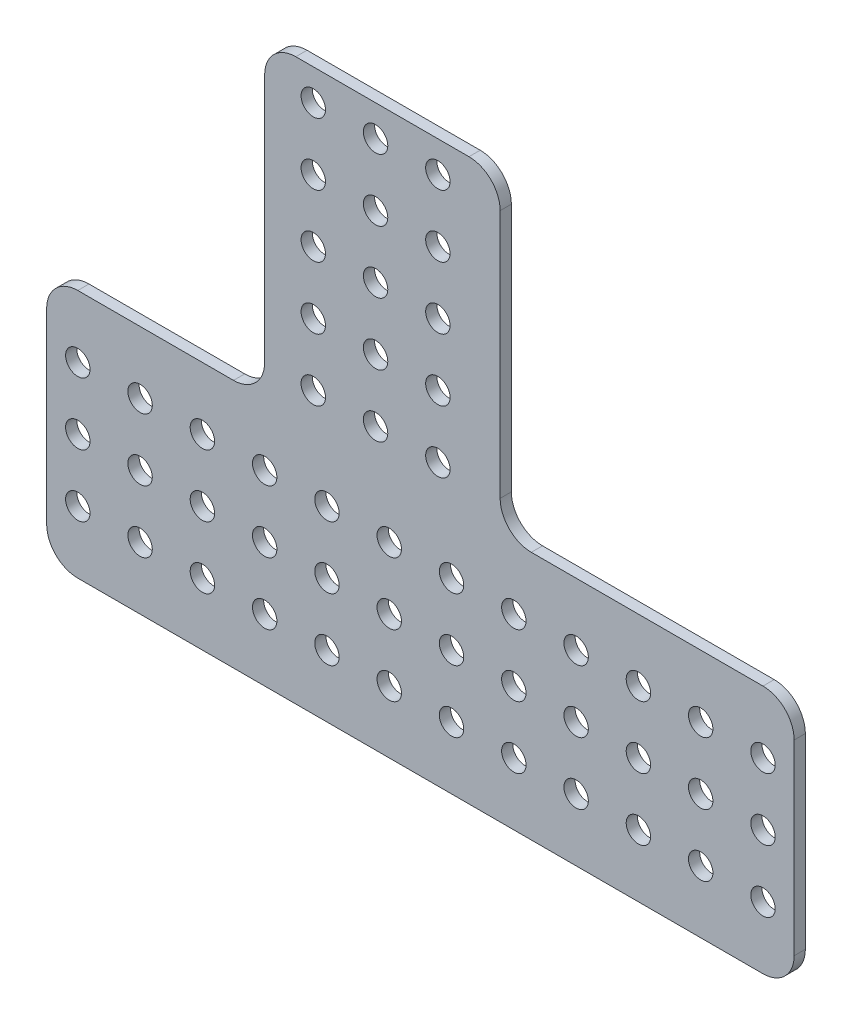
from build123d import *

# Parameters (mm, degrees)
SKETCH1_R           = 2.4892
BOSS_EXTRUDE1_DEPTH = 2.286


with BuildPart() as part:
    # Sketch1 → Boss-Extrude1 (new body)
    with BuildSketch(Plane.XY):
        with BuildLine():
            Line((-255.429010331, 188.842880428), (-220.118407496, 188.842880428))
            ThreePointArc((-220.118407496, 188.842880428), (-215.628279435, 186.983008489), (-213.768407496, 182.492880428))
            Line((-213.768407496, 182.492880428), (-213.768407496, 131.692880428))
            ThreePointArc((-213.768407496, 131.692880428), (-211.908535556, 127.202752368), (-207.418407496, 125.342880428))
            Line((-207.418407496, 125.342880428), (-160.179010331, 125.342880428))
            ThreePointArc((-160.179010331, 125.342880428), (-155.688882271, 123.483008489), (-153.829010331, 118.992880428))
            Line((-153.829010331, 118.992880428), (-153.829010331, 80.892880428))
            ThreePointArc((-153.829010331, 80.892880428), (-155.688882271, 76.402752368), (-160.179010331, 74.542880428))
            Line((-160.179010331, 74.542880428), (-299.879010331, 74.542880428))
            ThreePointArc((-299.879010331, 74.542880428), (-304.369138392, 76.402752368), (-306.229010331, 80.892880428))
            Line((-306.229010331, 80.892880428), (-306.229010331, 118.992880428))
            ThreePointArc((-306.229010331, 118.992880428), (-304.369138392, 123.483008489), (-299.879010331, 125.342880428))
            Line((-299.879010331, 125.342880428), (-268.129010331, 125.342880428))
            ThreePointArc((-268.129010331, 125.342880428), (-263.638882271, 127.202752368), (-261.779010331, 131.692880428))
            Line((-261.779010331, 131.692880428), (-261.779010331, 182.492880428))
            ThreePointArc((-261.779010331, 182.492880428), (-259.919138392, 186.983008489), (-255.429010331, 188.842880428))
        make_face()
        with Locations((-226.468407496, 157.092880428)):
            Circle(SKETCH1_R, mode=Mode.SUBTRACT)
        with Locations((-226.468407496, 144.392880428)):
            Circle(SKETCH1_R, mode=Mode.SUBTRACT)
        with Locations((-226.468407496, 131.692880428)):
            Circle(SKETCH1_R, mode=Mode.SUBTRACT)
        with Locations((-239.168407496, 131.692880428)):
            Circle(SKETCH1_R, mode=Mode.SUBTRACT)
        with Locations((-251.868407496, 131.692880428)):
            Circle(SKETCH1_R, mode=Mode.SUBTRACT)
        with Locations((-251.868407496, 144.392880428)):
            Circle(SKETCH1_R, mode=Mode.SUBTRACT)
        with Locations((-239.168407496, 144.392880428)):
            Circle(SKETCH1_R, mode=Mode.SUBTRACT)
        with Locations((-239.168407496, 157.092880428)):
            Circle(SKETCH1_R, mode=Mode.SUBTRACT)
        with Locations((-251.868407496, 157.092880428)):
            Circle(SKETCH1_R, mode=Mode.SUBTRACT)
        with Locations((-226.468407496, 169.792880428)):
            Circle(SKETCH1_R, mode=Mode.SUBTRACT)
        with Locations((-226.468407496, 182.492880428)):
            Circle(SKETCH1_R, mode=Mode.SUBTRACT)
        with Locations((-239.168407496, 182.492880428)):
            Circle(SKETCH1_R, mode=Mode.SUBTRACT)
        with Locations((-239.168407496, 169.792880428)):
            Circle(SKETCH1_R, mode=Mode.SUBTRACT)
        with Locations((-251.868407496, 169.792880428)):
            Circle(SKETCH1_R, mode=Mode.SUBTRACT)
        with Locations((-251.868407496, 182.492880428)):
            Circle(SKETCH1_R, mode=Mode.SUBTRACT)
        with Locations((-299.879010331, 112.642880428)):
            Circle(SKETCH1_R, mode=Mode.SUBTRACT)
        with Locations((-287.179010331, 112.642880428)):
            Circle(SKETCH1_R, mode=Mode.SUBTRACT)
        with Locations((-274.479010331, 112.642880428)):
            Circle(SKETCH1_R, mode=Mode.SUBTRACT)
        with Locations((-261.779010331, 112.642880428)):
            Circle(SKETCH1_R, mode=Mode.SUBTRACT)
        with Locations((-249.079010331, 112.642880428)):
            Circle(SKETCH1_R, mode=Mode.SUBTRACT)
        with Locations((-236.379010331, 112.642880428)):
            Circle(SKETCH1_R, mode=Mode.SUBTRACT)
        with Locations((-223.679010331, 112.642880428)):
            Circle(SKETCH1_R, mode=Mode.SUBTRACT)
        with Locations((-210.979010331, 112.642880428)):
            Circle(SKETCH1_R, mode=Mode.SUBTRACT)
        with Locations((-198.279010331, 112.642880428)):
            Circle(SKETCH1_R, mode=Mode.SUBTRACT)
        with Locations((-185.579010331, 112.642880428)):
            Circle(SKETCH1_R, mode=Mode.SUBTRACT)
        with Locations((-172.879010331, 112.642880428)):
            Circle(SKETCH1_R, mode=Mode.SUBTRACT)
        with Locations((-160.179010331, 112.642880428)):
            Circle(SKETCH1_R, mode=Mode.SUBTRACT)
        with Locations((-287.179010331, 99.942880428)):
            Circle(SKETCH1_R, mode=Mode.SUBTRACT)
        with Locations((-274.479010331, 99.942880428)):
            Circle(SKETCH1_R, mode=Mode.SUBTRACT)
        with Locations((-261.779010331, 99.942880428)):
            Circle(SKETCH1_R, mode=Mode.SUBTRACT)
        with Locations((-249.079010331, 99.942880428)):
            Circle(SKETCH1_R, mode=Mode.SUBTRACT)
        with Locations((-236.379010331, 99.942880428)):
            Circle(SKETCH1_R, mode=Mode.SUBTRACT)
        with Locations((-223.679010331, 99.942880428)):
            Circle(SKETCH1_R, mode=Mode.SUBTRACT)
        with Locations((-210.979010331, 99.942880428)):
            Circle(SKETCH1_R, mode=Mode.SUBTRACT)
        with Locations((-198.279010331, 99.942880428)):
            Circle(SKETCH1_R, mode=Mode.SUBTRACT)
        with Locations((-185.579010331, 99.942880428)):
            Circle(SKETCH1_R, mode=Mode.SUBTRACT)
        with Locations((-172.879010331, 99.942880428)):
            Circle(SKETCH1_R, mode=Mode.SUBTRACT)
        with Locations((-160.179010331, 99.942880428)):
            Circle(SKETCH1_R, mode=Mode.SUBTRACT)
        with Locations((-287.179010331, 87.242880428)):
            Circle(SKETCH1_R, mode=Mode.SUBTRACT)
        with Locations((-274.479010331, 87.242880428)):
            Circle(SKETCH1_R, mode=Mode.SUBTRACT)
        with Locations((-261.779010331, 87.242880428)):
            Circle(SKETCH1_R, mode=Mode.SUBTRACT)
        with Locations((-249.079010331, 87.242880428)):
            Circle(SKETCH1_R, mode=Mode.SUBTRACT)
        with Locations((-236.379010331, 87.242880428)):
            Circle(SKETCH1_R, mode=Mode.SUBTRACT)
        with Locations((-223.679010331, 87.242880428)):
            Circle(SKETCH1_R, mode=Mode.SUBTRACT)
        with Locations((-210.979010331, 87.242880428)):
            Circle(SKETCH1_R, mode=Mode.SUBTRACT)
        with Locations((-198.279010331, 87.242880428)):
            Circle(SKETCH1_R, mode=Mode.SUBTRACT)
        with Locations((-185.579010331, 87.242880428)):
            Circle(SKETCH1_R, mode=Mode.SUBTRACT)
        with Locations((-172.879010331, 87.242880428)):
            Circle(SKETCH1_R, mode=Mode.SUBTRACT)
        with Locations((-160.179010331, 87.242880428)):
            Circle(SKETCH1_R, mode=Mode.SUBTRACT)
        with Locations((-299.879010331, 99.942880428)):
            Circle(SKETCH1_R, mode=Mode.SUBTRACT)
        with Locations((-299.879010331, 87.242880428)):
            Circle(SKETCH1_R, mode=Mode.SUBTRACT)
    extrude(amount=BOSS_EXTRUDE1_DEPTH)


solid = part.part
